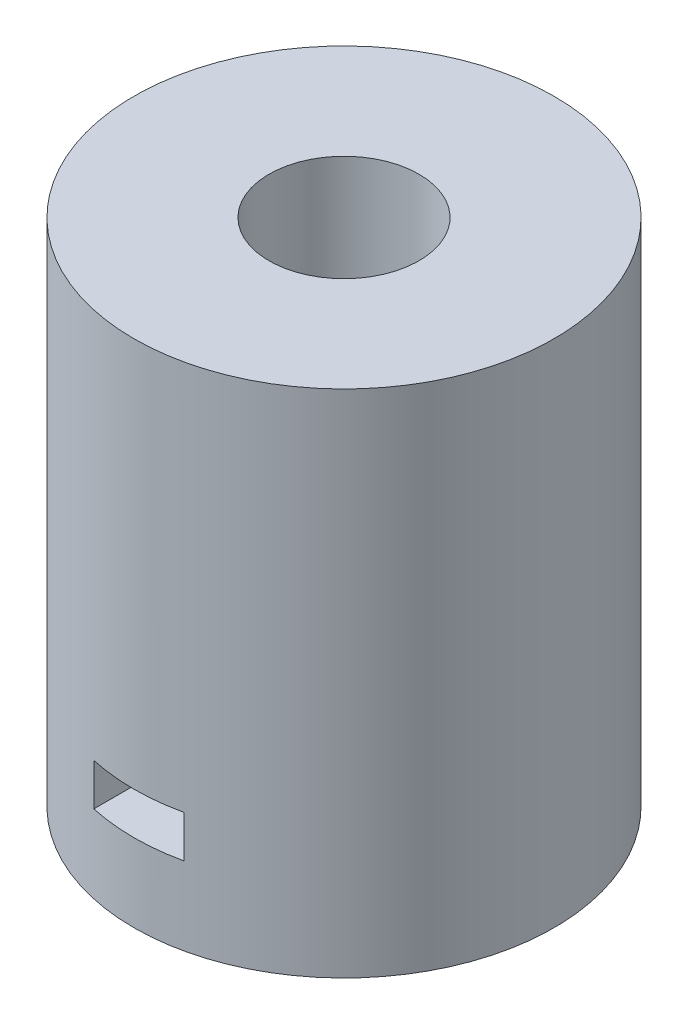
from build123d import *
from build123d.topology import SkipClean

# Parameters (mm, degrees)
SKETCH1_R           = 35
SKETCH1_R_2         = 3.15
BOSS_EXTRUDE1_DEPTH = 13
BOSS_EXTRUDE2_DEPTH = 7
SKETCH4_W           = 22.5
SKETCH4_H           = 65


with BuildPart() as part:
    # Sketch1 → Boss-Extrude1 (new body)
    with BuildSketch(Plane(origin=(0, 0, 0), x_dir=(1, 0, 0), z_dir=(0, 1, 0))):
        Circle(SKETCH1_R)
        with Locations((0, 15)):
            Circle(SKETCH1_R_2, mode=Mode.SUBTRACT)
        with Locations((0, -15)):
            Circle(SKETCH1_R_2, mode=Mode.SUBTRACT)
    extrude(amount=BOSS_EXTRUDE1_DEPTH)

    # Sketch2 → Boss-Extrude2 (add)
    with BuildSketch(Plane(origin=(0, 13, 0), x_dir=(1, 0, 0), z_dir=(0, 1, 0))):
        with BuildLine():
            ThreePointArc((35, 0), (27.271780287, 21.937410968), (7.5, 34.186985828))
            Line((7.5, 34.186985828), (7.5, 6.5))
            Line((7.5, 6.5), (-7.5, 6.5))
            Line((-7.5, 6.5), (-7.5, 34.186985828))
            ThreePointArc((-7.5, 34.186985828), (-35, 0), (-7.5, -34.186985828))
            Line((-7.5, -34.186985828), (-7.5, -6.5))
            Line((-7.5, -6.5), (7.5, -6.5))
            Line((7.5, -6.5), (7.5, -34.186985828))
            ThreePointArc((7.5, -34.186985828), (27.271780287, -21.937410968), (35, 0))
        make_face()
    extrude(amount=BOSS_EXTRUDE2_DEPTH)

    # Sketch4 → Revolve1 (revolve)
    with SkipClean():  # the faces are left unmerged after this step: merging them gives an invalid solid
        with BuildSketch(Plane.XY):
            with Locations((23.75, 52.5)):
                Rectangle(SKETCH4_W, SKETCH4_H)
        revolve(axis=Axis((0, 0, 0), (0, 1, 0)))


solid = part.part
